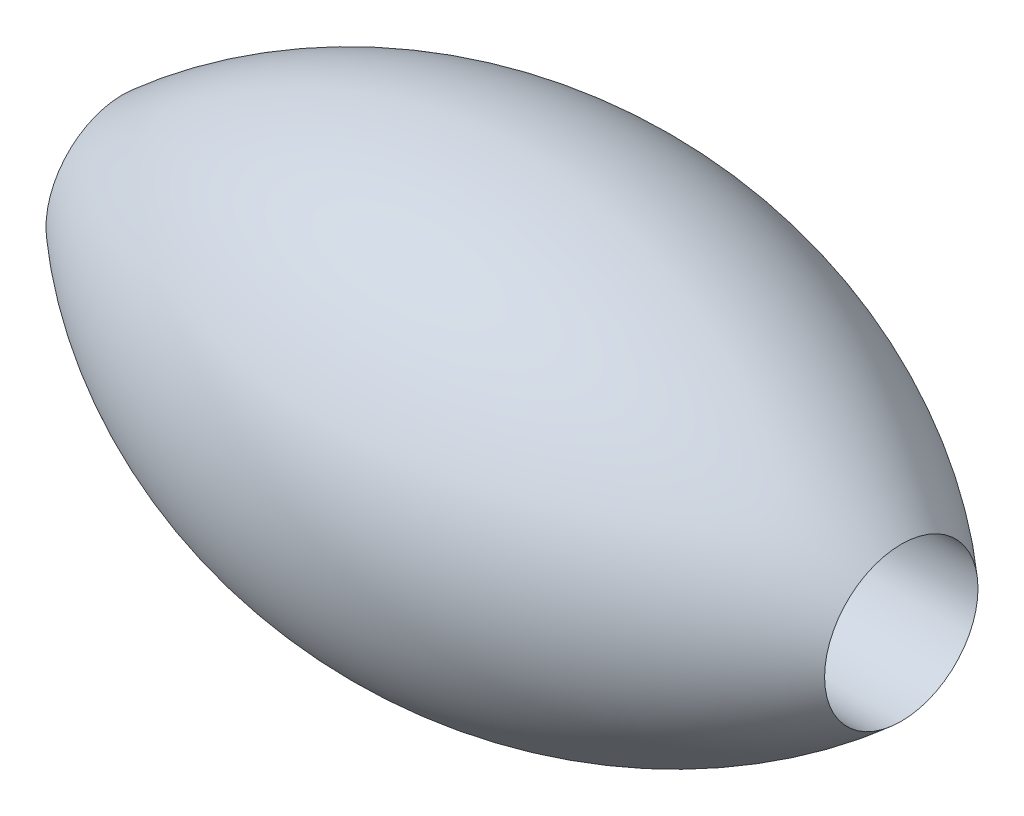
from build123d import *

# Parameters (mm, degrees)
INNER_LUMEN_DEPTH      = 6.948247608
INNER_LUMEN_DEPTH_BACK = 6.948247608
INNER_DIAMETER_R       = 0.52705


with BuildPart() as part:
    # Olive Tip → MainBody (revolve)
    with BuildSketch(Plane.XY):
        with BuildLine():
            Line((-5.537034775, 0), (0.812965225, 0))
            ThreePointArc((0.812965225, 0), (-2.362034775, -1.5367), (-5.537034775, 0))
        make_face()
    revolve(axis=Axis((-5.537034775, 0, 0), (1, 0, 0)))

    # Inner Diameter → Inner Lumen (cut, two sides: drawn at the far end of the back side and taken through both)
    with BuildSketch(Plane(origin=(0, 0, 0), x_dir=(0, 0, -1), z_dir=(1, 0, 0)).offset(-INNER_LUMEN_DEPTH_BACK)):
        Circle(INNER_DIAMETER_R)
    extrude(amount=INNER_LUMEN_DEPTH + INNER_LUMEN_DEPTH_BACK, mode=Mode.SUBTRACT)


solid = part.part
